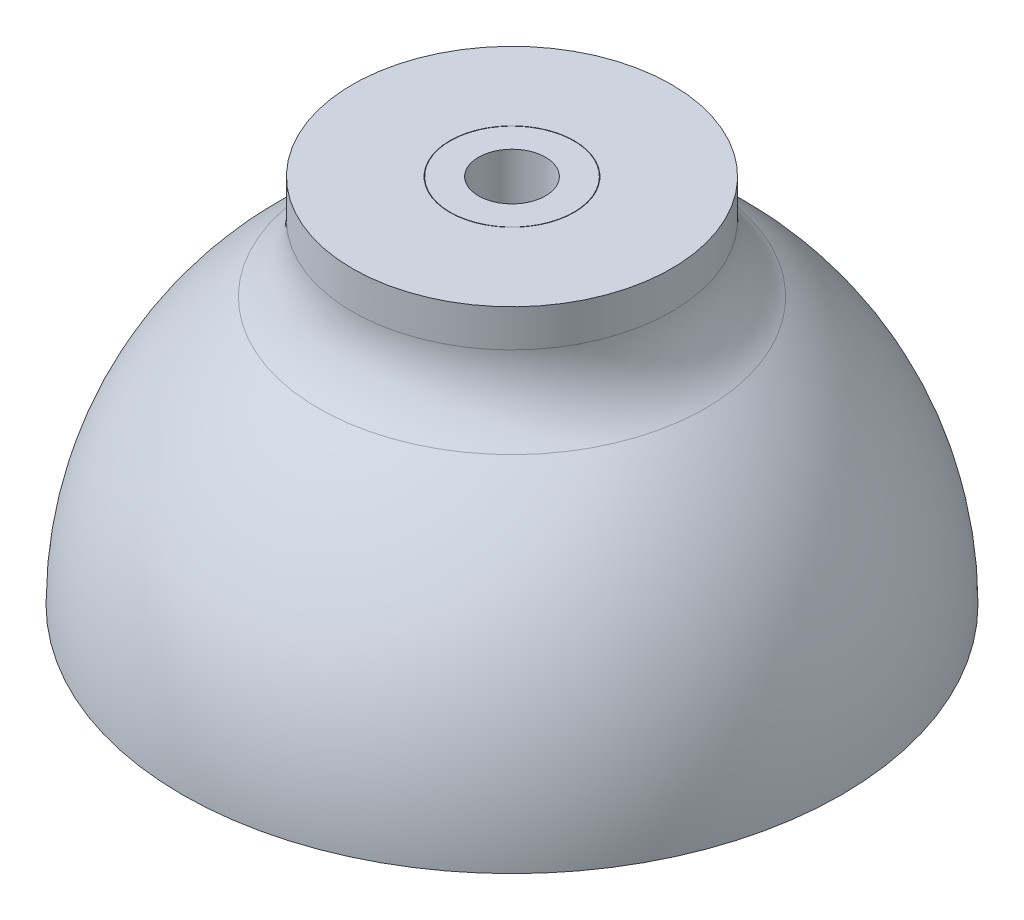
from build123d import *

# Parameters (mm, degrees)
SKIZZE14_R                      = 19.364916731
AUFSATZ_LINEAR_AUSTRAGEN1_DEPTH = 10
SCHNITT_LINEAR_START            = -1
SKIZZE3_R                       = 5.049999999
SCHNITT_LINEAR_AUSTRAGEN1_DEPTH = 7.8
KREISMUSTER1_COUNT              = 8
SKIZZE6_R                       = 5.049999988
SCHNITT_LINEAR_AUSTRAGEN2_DEPTH = 6.8
KREISMUSTER2_COUNT              = 8
SKIZZE8_R                       = 5.049999993
SCHNITT_LINEAR_AUSTRAGEN3_DEPTH = 6.8
KREISMUSTER3_COUNT              = 8
SKIZZE10_R                      = 5.049999982
SCHNITT_LINEAR_AUSTRAGEN4_DEPTH = 6.8
KREISMUSTER4_COUNT              = 8
SKIZZE12_R                      = 5.049999987
SCHNITT_LINEAR_AUSTRAGEN5_DEPTH = 6.8
KREISMUSTER5_COUNT              = 8
SKIZZE13_R                      = 7.55
SCHNITT_LINEAR_AUSTRAGEN6_DEPTH = 56.8
VERRUNDUNG1_R                   = 1
VERRUNDUNG2_R                   = 10


with BuildPart() as part:
    # Skizze1 → Rotation1 (revolve)
    with BuildSketch(Plane.XY):
        with BuildLine():
            Line((0, 30), (0, 40))
            ThreePointArc((0, 40), (-28.284271247, 28.284271247), (-40, 0))
            Line((-40, 0), (-30, 0))
            ThreePointArc((-30, 0), (-21.213203436, 21.213203436), (0, 30))
        make_face()
    revolve(axis=Axis((0, 30, 0), (0, 1, 0)))

    # Skizze14 → Aufsatz-Linear austragen1 (add)
    with BuildSketch(Plane(origin=(0, 35, 0), x_dir=(1, 0, 0), z_dir=(0, 1, 0))):
        Circle(SKIZZE14_R)
    extrude(amount=AUFSATZ_LINEAR_AUSTRAGEN1_DEPTH)

    # Skizze3 → Schnitt-Linear austragen1 (cut)
    with BuildSketch(Plane(origin=(-13.918715274, 26.089351566, 0), x_dir=(0, 0, 1), z_dir=(-0.47070393216533346, 0.8822912264349528, 0)).offset(SCHNITT_LINEAR_START)):
        with Locations((0, -0.000615906)):
            Circle(SKIZZE3_R)
    schnitt_linear_austragen1 = extrude(amount=SCHNITT_LINEAR_AUSTRAGEN1_DEPTH, mode=Mode.SUBTRACT)

    # Kreismuster1: Schnitt-Linear austragen1 ×8 about axis
    kreismuster1_axis = Axis((0, -2, 0), (0, 1, 0))
    for i in range(1, KREISMUSTER1_COUNT):
        add(schnitt_linear_austragen1.rotate(kreismuster1_axis, i * 360 / KREISMUSTER1_COUNT), mode=Mode.SUBTRACT)

    # Skizze6 → Schnitt-Linear austragen2 (cut, symmetric)
    with BuildSketch(Plane(origin=(-19.117591579, 21.123345895, -7.918765712), x_dir=(0.3826834323650906, 0, -0.9238795325112865), z_dir=(-0.6465198369629458, 0.7143505544619064, -0.267797284813295))):
        with Locations((0, -0.002073222)):
            Circle(SKIZZE6_R)
    schnitt_linear_austragen2 = extrude(amount=SCHNITT_LINEAR_AUSTRAGEN2_DEPTH, both=True, mode=Mode.SUBTRACT)

    # Kreismuster2: Schnitt-Linear austragen2 ×8 about axis
    kreismuster2_axis = Axis((0, -2, 0), (0, 1, 0))
    for i in range(1, KREISMUSTER2_COUNT):
        add(schnitt_linear_austragen2.rotate(kreismuster2_axis, i * 360 / KREISMUSTER2_COUNT), mode=Mode.SUBTRACT)

    # Skizze8 → Schnitt-Linear austragen3 (cut, symmetric)
    with BuildSketch(Plane(origin=(-24.589423325, 16.423920377, 0), x_dir=(0, 0, 1), z_dir=(-0.8315665649359705, 0.555425105734869, 0))):
        with Locations((0, 0.001530457)):
            Circle(SKIZZE8_R)
    schnitt_linear_austragen3 = extrude(amount=SCHNITT_LINEAR_AUSTRAGEN3_DEPTH, both=True, mode=Mode.SUBTRACT)

    # Kreismuster3: Schnitt-Linear austragen3 ×8 about axis
    kreismuster3_axis = Axis((0, -2, 0), (0, 1, 0))
    for i in range(1, KREISMUSTER3_COUNT):
        add(schnitt_linear_austragen3.rotate(kreismuster3_axis, i * 360 / KREISMUSTER3_COUNT), mode=Mode.SUBTRACT)

    # Skizze10 → Schnitt-Linear austragen4 (cut, symmetric)
    with BuildSketch(Plane(origin=(24.783655815, 12.440665846, 10.265726364), x_dir=(0.3826834323650906, 0, -0.9238795325112864), z_dir=(0.8381351306923461, 0.42071916963275224, 0.3471669382341172))):
        with Locations((0, -0.002464137)):
            Circle(SKIZZE10_R)
    schnitt_linear_austragen4 = extrude(amount=SCHNITT_LINEAR_AUSTRAGEN4_DEPTH, both=True, mode=Mode.SUBTRACT)

    # Kreismuster4: Schnitt-Linear austragen4 ×8 about axis
    kreismuster4_axis = Axis((0, -2, 0), (0, 1, 0))
    for i in range(1, KREISMUSTER4_COUNT):
        add(schnitt_linear_austragen4.rotate(kreismuster4_axis, i * 360 / KREISMUSTER4_COUNT), mode=Mode.SUBTRACT)

    # Skizze12 → Schnitt-Linear austragen5 (cut, symmetric)
    with BuildSketch(Plane(origin=(28.809799143, 6.6618596, 0), x_dir=(0, 0, 1), z_dir=(0.9742914826937294, 0.22529115994742066, 0))):
        with Locations((0, -0.00215437)):
            Circle(SKIZZE12_R)
    schnitt_linear_austragen5 = extrude(amount=SCHNITT_LINEAR_AUSTRAGEN5_DEPTH, both=True, mode=Mode.SUBTRACT)

    # Kreismuster5: Schnitt-Linear austragen5 ×8 about axis
    kreismuster5_axis = Axis((0, -2, 0), (0, 1, 0))
    for i in range(1, KREISMUSTER5_COUNT):
        add(schnitt_linear_austragen5.rotate(kreismuster5_axis, i * 360 / KREISMUSTER5_COUNT), mode=Mode.SUBTRACT)

    # Skizze13 → Schnitt-Linear austragen6 (cut)
    with BuildSketch(Plane(origin=(0, 0, 0), x_dir=(1, 0, 0), z_dir=(0, 1, 0))):
        Circle(SKIZZE13_R)
    extrude(amount=SCHNITT_LINEAR_AUSTRAGEN6_DEPTH, mode=Mode.SUBTRACT)

    # Verrundung1
    verrundung1_edges = [part.edges().sort_by_distance(p)[0] for p in [
        (0, 29.03441923, -7.55),
    ]]
    fillet(verrundung1_edges, radius=VERRUNDUNG1_R)

    # Verrundung2
    verrundung2_edges = [part.edges().sort_by_distance(p)[0] for p in [
        (0, 35, 19.364916731),
    ]]
    fillet(verrundung2_edges, radius=VERRUNDUNG2_R)


with BuildPart() as body_2:
    # Skizze16 → Rotation2 (revolve)
    with BuildSketch(Plane.XY):
        Polygon((7.5, 28.836395772), (4.07, 28.836395772), (4.07, 45), (7.5, 45), (7.5, 29.797608964), align=None)
    revolve(axis=Axis((0, 46.102336211, 0), (0, -1, 0)))


solid = Compound([part.part, body_2.part])
